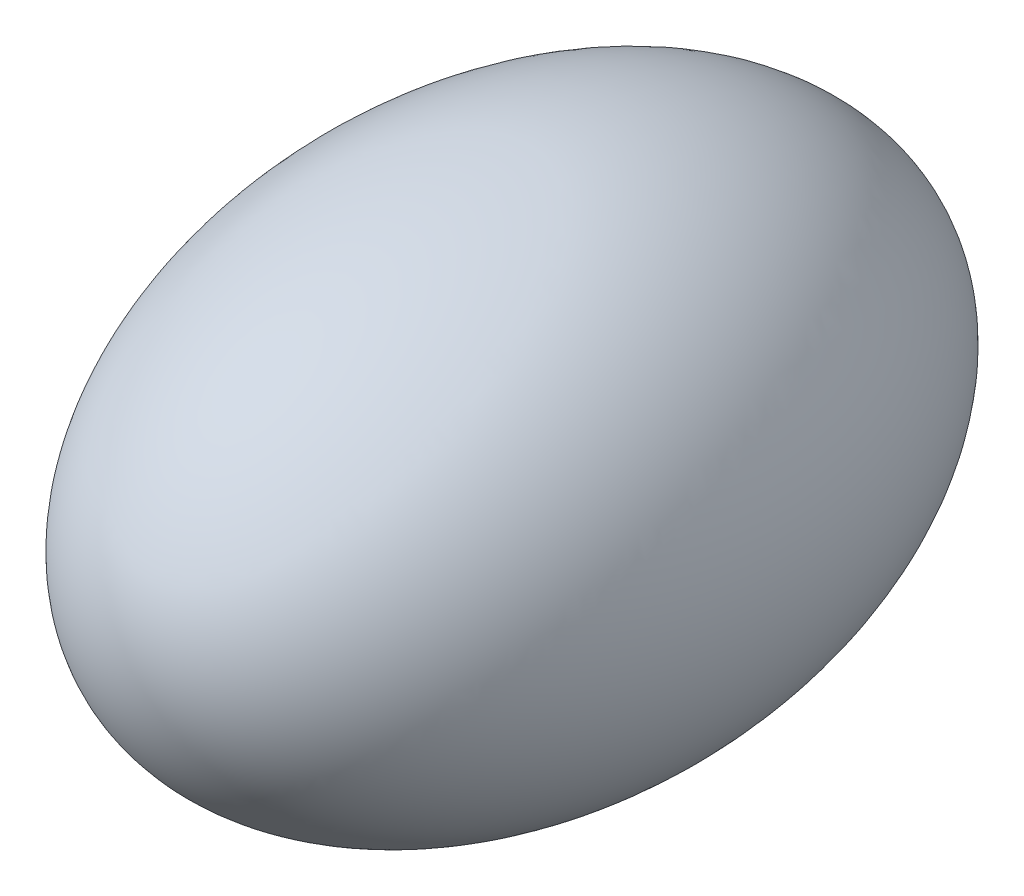
from build123d import *


with BuildPart() as part:
    # Sketch1 → Revolve5 (revolve)
    with BuildSketch(Plane(origin=(0, 0, 0), x_dir=(1, 0, 0), z_dir=(0, 1, 0))):
        with BuildLine():
            Line((0, 75), (0, -75))
            add(Edge.make_bspline(
                [(0, -75), (50, -75), (50, 0), (50, 75), (0, 75)],
                knots=[3.141592654, 3.141592654, 3.141592654, 4.71238898, 4.71238898, 6.283185307, 6.283185307, 6.283185307], degree=2, weights=[1, 0.707106781, 1, 0.707106781, 1]))
        make_face()
    revolve(axis=Axis((0, 0, -75), (0, 0, -1)))


solid = part.part
